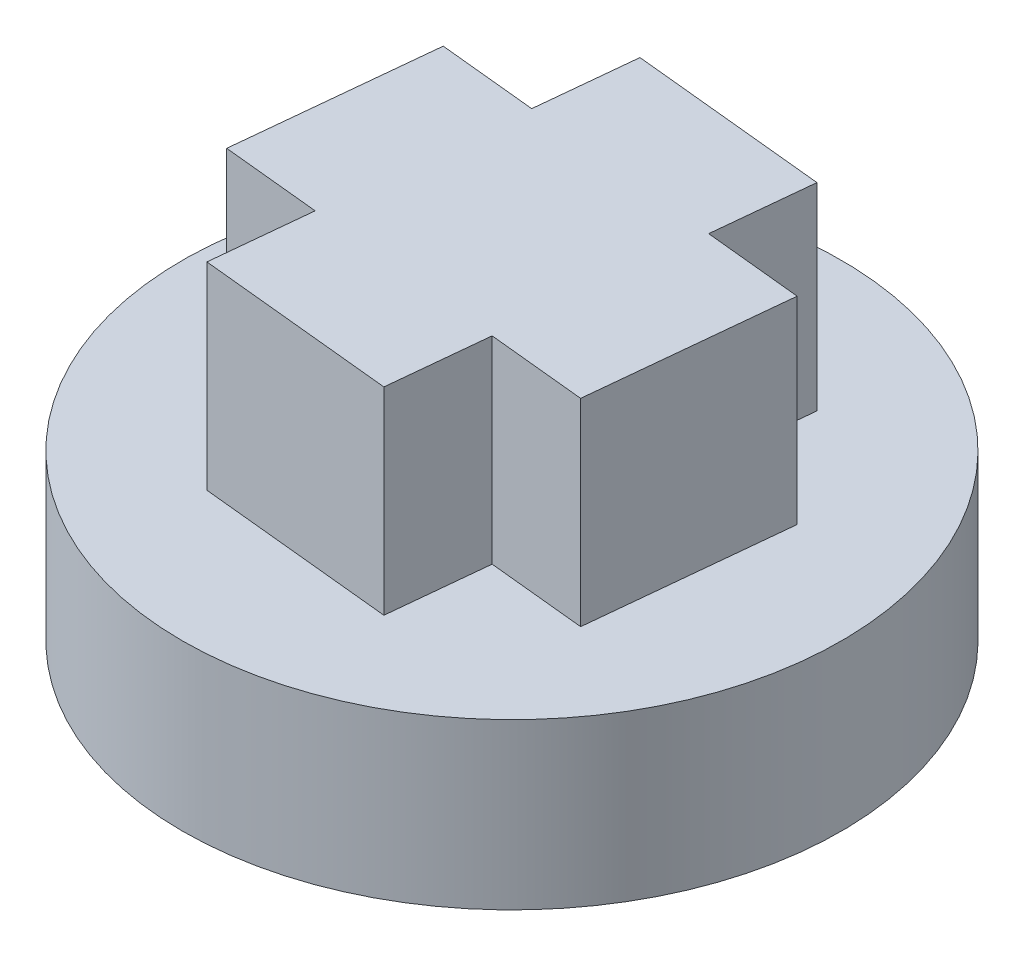
from build123d import *

# Parameters (mm, degrees)
SKETCH_1_R      = 5
EXTRUDE_1_DEPTH = 2
EXTRUDE_2_DEPTH = 3.5
EXTRUDE_3_DEPTH = 3.5
SKETCH_4_R      = 5
EXTRUDE_4_DEPTH = 0.5


with BuildPart() as part:
    # 草图1 → 凸台-拉伸1 (new body)
    with BuildSketch(Plane(origin=(0, 0, 0), x_dir=(1, 0, 0), z_dir=(0, 1, 0))):
        Circle(SKETCH_1_R)
        Polygon((2.55392077, -1.838021228), (2.868733461, 1.292749652), (0.314812691, 3.13077088), (-2.55392077, 1.838021228), (-2.868733461, -1.292749652), (-0.314812691, -3.13077088), align=None, mode=Mode.SUBTRACT)
    extrude(amount=EXTRUDE_1_DEPTH)

    # 草图2 → 凸台-拉伸2 (add)
    with BuildSketch(Plane(origin=(0, 2, 0), x_dir=(1, 0, 0), z_dir=(0, 1, 0))):
        Polygon((-2.834872538, 1.792623133), (3.135022029, 1.192324151), (2.834872538, -1.792623133), (-3.135022029, -1.192324151), align=None)
    extrude(amount=EXTRUDE_2_DEPTH)

    # 草图3 → 凸台-拉伸3 (add)
    with BuildSketch(Plane(origin=(0, 2, 0), x_dir=(1, 0, 0), z_dir=(0, 1, 0))):
        Polygon((-1.192324151, 3.135022029), (-1.792623133, -2.834872538), (1.192324151, -3.135022029), (1.792623133, 2.834872538), align=None)
    extrude(amount=EXTRUDE_3_DEPTH)

    # 草图4 → 凸台-拉伸4 (add)
    with BuildSketch(Plane(origin=(0, 2, 0), x_dir=(1, 0, 0), z_dir=(0, 1, 0))):
        Circle(SKETCH_4_R)
    extrude(amount=EXTRUDE_4_DEPTH)


solid = part.part
